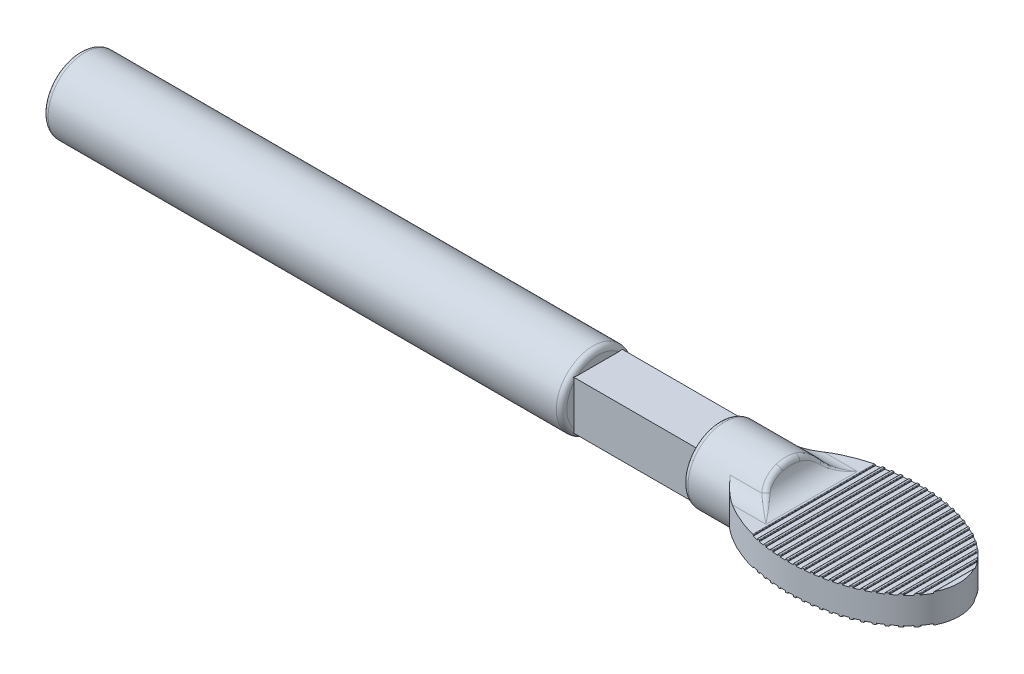
from build123d import *

# Parameters (mm, degrees)
SKETCH1_R              = 3.5
BOSS_EXTRUDE1_DEPTH    = 67.5
CUT_EXTRUDE1_START     = 55
SKETCH2_OUTSIDE_W      = 22.644
SKETCH2_OUTSIDE_H      = 22.644
SKETCH2_OUTSIDE_W_2    = 4.596194078
SKETCH2_OUTSIDE_H_2    = 4.596194078
CUT_EXTRUDE1_DEPTH     = 5.75
SKETCH3_RX             = 10
SKETCH3_RY             = 6.25
BOSS_EXTRUDE2_DEPTH    = 1.375
FILLET1_R              = 2
FILLET2_R              = 0.5
SKETCH4_W              = 0.5
SKETCH4_H              = 0.125
CUT_EXTRUDE2_DEPTH     = 11.375
FILLET3_R              = 0.05
LPATTERN1_COUNT        = 18
LPATTERN1_PITCH        = 0.75
FILLET3_OF_LPATTERN1_R = 0.05
FILLET4_R              = 0.5


with BuildPart() as part:
    # Sketch1 → Boss-Extrude1 (new body)
    with BuildSketch(Plane(origin=(0, 0, 0), x_dir=(0, 0, -1), z_dir=(1, 0, 0))):
        Circle(SKETCH1_R)
    extrude(amount=BOSS_EXTRUDE1_DEPTH)

    # Sketch2 outside → Cut-Extrude1 (cut, symmetric)
    with BuildSketch(Plane(origin=(0, 0, 0), x_dir=(0, 0, -1), z_dir=(1, 0, 0)).offset(CUT_EXTRUDE1_START)):
        Rectangle(SKETCH2_OUTSIDE_W, SKETCH2_OUTSIDE_H)
        Rectangle(SKETCH2_OUTSIDE_W_2, SKETCH2_OUTSIDE_H_2, mode=Mode.SUBTRACT)
    extrude(amount=CUT_EXTRUDE1_DEPTH, both=True, mode=Mode.SUBTRACT)

    # Sketch3 → Boss-Extrude2 (add, symmetric)
    with BuildSketch(Plane(origin=(0, 0, 0), x_dir=(1, 0, 0), z_dir=(0, 1, 0))):
        with Locations((73.5, 0)):
            Ellipse(SKETCH3_RX, SKETCH3_RY)
    extrude(amount=BOSS_EXTRUDE2_DEPTH, both=True)

    # Fillet1
    fillet1_edges = [part.edges().sort_by_distance(p)[0] for p in [
        (66.213976202, 1.375, -3.218598297),
        (66.213976202, 1.375, 3.218598297),
        (67.5, 1.375, 0),
        (66.213976202, -1.375, -3.218598297),
        (66.213976202, -1.375, 3.218598297),
        (67.5, -1.375, 0),
    ]]
    fillet(fillet1_edges, radius=FILLET1_R)

    # Fillet2
    fillet2_edges = [part.edges().sort_by_distance(p)[0] for p in [
        (68.659705257, 1.560088227, -3.502443449),
        (67.559173069, 2.892101657, -1.971230071),
        (68.659705257, 1.560088227, 3.502443449),
        (67.559173068, 2.892101657, 1.971230072),
        (68.659705257, -1.560088227, 3.502443449),
        (67.559173068, -2.892101657, 1.971230072),
        (68.659705257, -1.560088227, -3.502443449),
        (67.559173069, -2.892101657, -1.971230071),
        (67.5, 3.5, 0),
        (67.5, -3.5, 0),
    ]]
    fillet(fillet2_edges, radius=FILLET2_R)

    # Sketch4 → Cut-Extrude2 (cut, symmetric)
    with BuildSketch(Plane.XY):
        with Locations((82.75, 1.3125)):
            Rectangle(SKETCH4_W, SKETCH4_H)
        with Locations((82.75, -1.3125)):
            Rectangle(SKETCH4_W, SKETCH4_H)
    cut_extrude2 = extrude(amount=CUT_EXTRUDE2_DEPTH, both=True, mode=Mode.SUBTRACT)

    # Fillet3
    fillet3_edges = [part.edges().sort_by_distance(p)[0] for p in [
        (83, -1.375, 0),
        (82.5, -1.375, 0),
        (83, 1.375, 0),
        (82.5, 1.375, 0),
    ]]
    fillet(fillet3_edges, radius=FILLET3_R)

    # LPattern1: Cut-Extrude2 ×18
    with Locations(*[(-i * LPATTERN1_PITCH, 0, 0) for i in range(1, LPATTERN1_COUNT)]):
        add(cut_extrude2, mode=Mode.SUBTRACT)

    # Fillet3 of LPattern1
    fillet3_of_lpattern1_edges = [part.edges().sort_by_distance(p)[0] for p in [
        (82.25, -1.375, 0),
        (81.75, -1.375, 0),
        (82.25, 1.375, 0),
        (81.75, 1.375, 0),
        (81.5, -1.375, 0),
        (81, -1.375, 0),
        (81.5, 1.375, 0),
        (81, 1.375, 0),
        (80.75, -1.375, 0),
        (80.25, -1.375, 0),
        (80.75, 1.375, 0),
        (80.25, 1.375, 0),
        (80, -1.375, 0),
        (79.5, -1.375, 0),
        (80, 1.375, 0),
        (79.5, 1.375, 0),
        (79.25, -1.375, 0),
        (78.75, -1.375, 0),
        (79.25, 1.375, 0),
        (78.75, 1.375, 0),
        (78.5, -1.375, 0),
        (78, -1.375, 0),
        (78.5, 1.375, 0),
        (78, 1.375, 0),
        (77.75, -1.375, 0),
        (77.25, -1.375, 0),
        (77.75, 1.375, 0),
        (77.25, 1.375, 0),
        (77, -1.375, 0),
        (76.5, -1.375, 0),
        (77, 1.375, 0),
        (76.5, 1.375, 0),
        (76.25, -1.375, 0),
        (75.75, -1.375, 0),
        (76.25, 1.375, 0),
        (75.75, 1.375, 0),
        (75.5, -1.375, 0),
        (75, -1.375, 0),
        (75.5, 1.375, 0),
        (75, 1.375, 0),
        (74.75, -1.375, 0),
        (74.25, -1.375, 0),
        (74.75, 1.375, 0),
        (74.25, 1.375, 0),
        (74, -1.375, 0),
        (73.5, -1.375, 0),
        (74, 1.375, 0),
        (73.5, 1.375, 0),
        (73.25, -1.375, 0),
        (72.75, -1.375, 0),
        (73.25, 1.375, 0),
        (72.75, 1.375, 0),
        (72.5, -1.375, 0),
        (72, -1.375, 0),
        (72.5, 1.375, 0),
        (72, 1.375, 0),
        (71.75, -1.375, 0),
        (71.25, -1.375, 0),
        (71.75, 1.375, 0),
        (71.25, 1.375, 0),
        (71, -1.375, 0),
        (70.5, -1.375, 0),
        (71, 1.375, 0),
        (70.5, 1.375, 0),
        (70.25, -1.375, 0),
        (69.75, -1.375, 0),
        (70.25, 1.375, 0),
        (69.75, 1.375, 0),
    ]]
    fillet(fillet3_of_lpattern1_edges, radius=FILLET3_OF_LPATTERN1_R)

    # Fillet4
    # the kernel refuses this fillet: 0.5 mm, written as the material it takes off along each edge
    with BuildSketch(Plane(origin=(49.25, 0, 0), x_dir=(0, 0, -1), z_dir=(0, 1, 0))) as fillet4_piece_1_section:
        with BuildLine():
            CenterArc((3.5 - FILLET4_R, FILLET4_R), FILLET4_R, 270, 90)
            Line((3.5, FILLET4_R), (3.5, 0))
            Line((3.5, 0), (3.5 - FILLET4_R, 0))
        make_face()
    fillet4_piece_1 = revolve(axis=Axis((49.25, 0, 0), (-1, 0, 0)), mode=Mode.PRIVATE)
    fillet4_piece_1 = split(fillet4_piece_1, bisect_by=Plane(origin=(49.108122235, -1.285097744, -2.298097039), z_dir=(0, 0, -1)), keep=Keep.TOP, mode=Mode.PRIVATE)
    add(fillet4_piece_1, mode=Mode.SUBTRACT)
    with BuildSketch(Plane(origin=(49.25, 0, 0), x_dir=(0, 0, -1), z_dir=(0, 1, 0))) as fillet4_piece_2_section:
        with BuildLine():
            CenterArc((3.5 - FILLET4_R, FILLET4_R), FILLET4_R, 270, 90)
            Line((3.5, FILLET4_R), (3.5, 0))
            Line((3.5, 0), (3.5 - FILLET4_R, 0))
        make_face()
    fillet4_piece_2 = revolve(axis=Axis((49.25, 0, 0), (-1, 0, 0)), mode=Mode.PRIVATE)
    fillet4_piece_2 = split(fillet4_piece_2, bisect_by=Plane(origin=(49.108122239, -2.298097039, 0), z_dir=(0, -1, 0)), keep=Keep.TOP, mode=Mode.PRIVATE)
    add(fillet4_piece_2, mode=Mode.SUBTRACT)
    with BuildSketch(Plane(origin=(49.25, 0, 0), x_dir=(0, 0, -1), z_dir=(0, 1, 0))) as fillet4_piece_3_section:
        with BuildLine():
            CenterArc((3.5 - FILLET4_R, FILLET4_R), FILLET4_R, 270, 90)
            Line((3.5, FILLET4_R), (3.5, 0))
            Line((3.5, 0), (3.5 - FILLET4_R, 0))
        make_face()
    fillet4_piece_3 = revolve(axis=Axis((49.25, 0, 0), (-1, 0, 0)), mode=Mode.PRIVATE)
    fillet4_piece_3 = split(fillet4_piece_3, bisect_by=Plane(origin=(49.108122239, 2.298097039, 0), z_dir=(0, 1, 0)), keep=Keep.TOP, mode=Mode.PRIVATE)
    add(fillet4_piece_3, mode=Mode.SUBTRACT)
    with BuildSketch(Plane(origin=(49.25, 0, 0), x_dir=(0, 0, -1), z_dir=(0, 1, 0))) as fillet4_piece_4_section:
        with BuildLine():
            CenterArc((3.5 - FILLET4_R, FILLET4_R), FILLET4_R, 270, 90)
            Line((3.5, FILLET4_R), (3.5, 0))
            Line((3.5, 0), (3.5 - FILLET4_R, 0))
        make_face()
    fillet4_piece_4 = revolve(axis=Axis((49.25, 0, 0), (-1, 0, 0)), mode=Mode.PRIVATE)
    fillet4_piece_4 = split(fillet4_piece_4, bisect_by=Plane(origin=(49.108122239, 0, 2.298097039), z_dir=(0, 0, 1)), keep=Keep.TOP, mode=Mode.PRIVATE)
    add(fillet4_piece_4, mode=Mode.SUBTRACT)
    with BuildSketch(Plane(origin=(0, 0, 0), x_dir=(0, 0, -1), z_dir=(0, -1, 0))) as fillet4_piece_5:
        with BuildLine():
            CenterArc((3.5 - FILLET4_R, FILLET4_R), FILLET4_R, 270, 90)
            Line((3.5 - FILLET4_R, 0), (3.5, 0))
            Line((3.5, 0), (3.5, FILLET4_R))
        make_face()
    revolve(axis=Axis((0, 0, 0), (1, 0, 0)), mode=Mode.SUBTRACT)
    with BuildSketch(Plane(origin=(60.75, 0, 0), x_dir=(0, 0, -1), z_dir=(0, 1, 0))) as fillet4_piece_6_section:
        with BuildLine():
            CenterArc((3.5 - FILLET4_R, -FILLET4_R), FILLET4_R, 0, 90)
            Line((3.5 - FILLET4_R, 0), (3.5, 0))
            Line((3.5, 0), (3.5, -FILLET4_R))
        make_face()
    fillet4_piece_6 = revolve(axis=Axis((60.75, 0, 0), (-1, 0, 0)), mode=Mode.PRIVATE)
    fillet4_piece_6 = split(fillet4_piece_6, bisect_by=Plane(origin=(60.891877765, -1.285097744, -2.298097039), z_dir=(0, 0, -1)), keep=Keep.TOP, mode=Mode.PRIVATE)
    add(fillet4_piece_6, mode=Mode.SUBTRACT)
    with BuildSketch(Plane(origin=(60.75, 0, 0), x_dir=(0, 0, -1), z_dir=(0, 1, 0))) as fillet4_piece_7_section:
        with BuildLine():
            CenterArc((3.5 - FILLET4_R, -FILLET4_R), FILLET4_R, 0, 90)
            Line((3.5 - FILLET4_R, 0), (3.5, 0))
            Line((3.5, 0), (3.5, -FILLET4_R))
        make_face()
    fillet4_piece_7 = revolve(axis=Axis((60.75, 0, 0), (-1, 0, 0)), mode=Mode.PRIVATE)
    fillet4_piece_7 = split(fillet4_piece_7, bisect_by=Plane(origin=(60.891877761, -2.298097039, 0), z_dir=(0, -1, 0)), keep=Keep.TOP, mode=Mode.PRIVATE)
    add(fillet4_piece_7, mode=Mode.SUBTRACT)
    with BuildSketch(Plane(origin=(60.75, 0, 0), x_dir=(0, 0, -1), z_dir=(0, 1, 0))) as fillet4_piece_8_section:
        with BuildLine():
            CenterArc((3.5 - FILLET4_R, -FILLET4_R), FILLET4_R, 0, 90)
            Line((3.5 - FILLET4_R, 0), (3.5, 0))
            Line((3.5, 0), (3.5, -FILLET4_R))
        make_face()
    fillet4_piece_8 = revolve(axis=Axis((60.75, 0, 0), (-1, 0, 0)), mode=Mode.PRIVATE)
    fillet4_piece_8 = split(fillet4_piece_8, bisect_by=Plane(origin=(60.891877761, 2.298097039, 0), z_dir=(0, 1, 0)), keep=Keep.TOP, mode=Mode.PRIVATE)
    add(fillet4_piece_8, mode=Mode.SUBTRACT)
    with BuildSketch(Plane(origin=(60.75, 0, 0), x_dir=(0, 0, -1), z_dir=(0, 1, 0))) as fillet4_piece_9_section:
        with BuildLine():
            CenterArc((3.5 - FILLET4_R, -FILLET4_R), FILLET4_R, 0, 90)
            Line((3.5 - FILLET4_R, 0), (3.5, 0))
            Line((3.5, 0), (3.5, -FILLET4_R))
        make_face()
    fillet4_piece_9 = revolve(axis=Axis((60.75, 0, 0), (-1, 0, 0)), mode=Mode.PRIVATE)
    fillet4_piece_9 = split(fillet4_piece_9, bisect_by=Plane(origin=(60.891877761, 0, 2.298097039), z_dir=(0, 0, 1)), keep=Keep.TOP, mode=Mode.PRIVATE)
    add(fillet4_piece_9, mode=Mode.SUBTRACT)


solid = part.part
